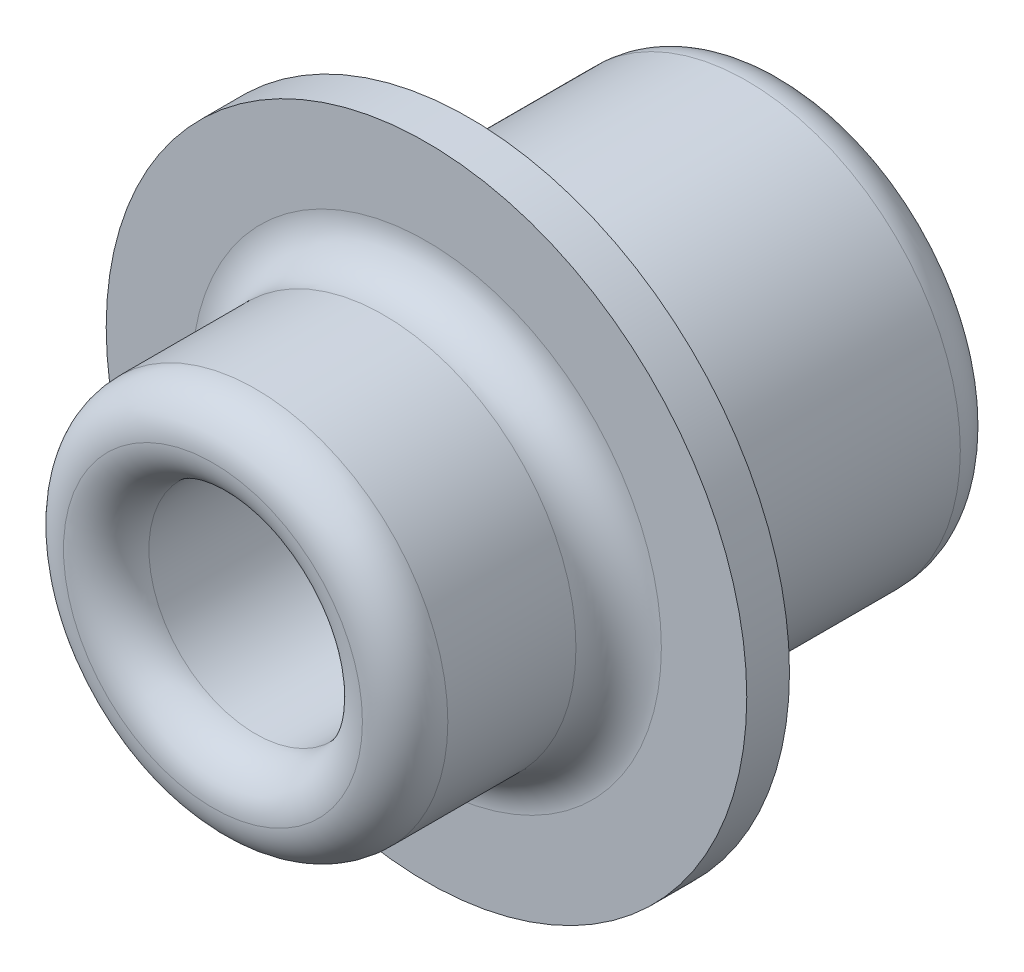
from build123d import *

# Parameters (mm, degrees)
SKETCH_1_R      = 10
SKETCH_1_R_2    = 5.1
EXTRUDE_1_DEPTH = 15
SKETCH_2_R      = 15
SKETCH_2_R_2    = 5
EXTRUDE_2_DEPTH = 2
SKETCH_3_R      = 9
SKETCH_3_R_2    = 5
EXTRUDE_3_DEPTH = 10
FILLET_1_R      = 2


with BuildPart() as part:
    # 草图1 → 凸台-拉伸1 (new body)
    with BuildSketch(Plane.XY):
        Circle(SKETCH_1_R)
        Circle(SKETCH_1_R_2, mode=Mode.SUBTRACT)
    extrude(amount=EXTRUDE_1_DEPTH)

    # 草图2 → 凸台-拉伸2 (add)
    with BuildSketch(Plane.XY.offset(15)):
        Circle(SKETCH_2_R)
        Circle(SKETCH_2_R_2, mode=Mode.SUBTRACT)
    extrude(amount=EXTRUDE_2_DEPTH)

    # 草图3 → 凸台-拉伸3 (add)
    with BuildSketch(Plane.XY.offset(17)):
        Circle(SKETCH_3_R)
        Circle(SKETCH_3_R_2, mode=Mode.SUBTRACT)
    extrude(amount=EXTRUDE_3_DEPTH)

    # 圆角1
    fillet_1_edges = [part.edges().sort_by_distance(p)[0] for p in [
        (-9, 0, 17),
        (-9, 0, 27),
        (-5, 0, 27),
        (-10, 0, 0),
    ]]
    fillet(fillet_1_edges, radius=FILLET_1_R - 0.0001)  # a hair under: the kernel refuses the full size


solid = part.part
